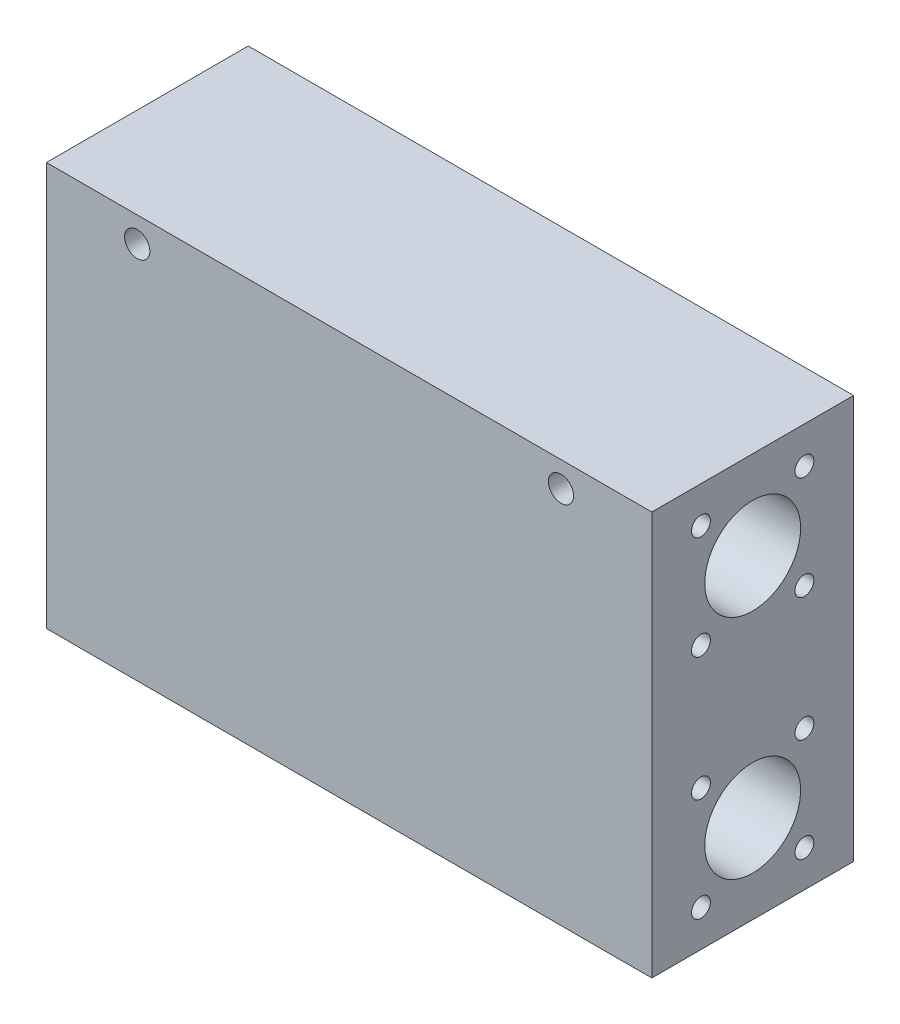
from build123d import *

# Parameters (mm, degrees)
SKETCH1_W                        = 120
SKETCH1_H                        = 80
BOSS_EXTRUDE1_DEPTH              = 40
SKETCH2_R                        = 1.85
LINEAR_BEARING_SCREW_CUTS_DEPTH  = 14
SKETCH3_R                        = 9.5
LINEAR_BEARINGS_HOLE_DEPTH       = 55
SKETCH4_R                        = 1.875
LINEAR_BEARING_SCREW_CUTS2_DEPTH = 14
LINEAR_BEARINGS_HOLE2_START      = -55
SKETCH5_R                        = 9.5
LINEAR_BEARINGS_HOLE2_DEPTH      = 55
SKETCH12_R                       = 6
CUT_EXTRUDE9_DEPTH               = 111.566721937
SKETCH13_R                       = 2.5
CUT_EXTRUDE10_DEPTH              = 150.666295471


with BuildPart() as part:
    # Sketch1 → Boss-Extrude1 (new body)
    with BuildSketch(Plane.XY):
        with Locations((60, 40)):
            Rectangle(SKETCH1_W, SKETCH1_H)
    extrude(amount=BOSS_EXTRUDE1_DEPTH)

    # Sketch2 → linear-bearing-screw-cuts (cut)
    with BuildSketch(Plane.ZY):
        with Locations((30.25, 72.75)):
            Circle(SKETCH2_R)
        with Locations((9.75, 72.75)):
            Circle(SKETCH2_R)
        with Locations((30.25, 52.25)):
            Circle(SKETCH2_R)
        with Locations((9.75, 52.25)):
            Circle(SKETCH2_R)
        with Locations((9.75, 27.75)):
            Circle(SKETCH2_R)
        with Locations((30.25, 27.75)):
            Circle(SKETCH2_R)
        with Locations((30.25, 7.25)):
            Circle(SKETCH2_R)
        with Locations((9.75, 7.25)):
            Circle(SKETCH2_R)
    extrude(amount=-LINEAR_BEARING_SCREW_CUTS_DEPTH, mode=Mode.SUBTRACT)

    # Sketch3 → linear-bearings-hole (cut)
    with BuildSketch(Plane.ZY):
        with Locations((20, 62.5)):
            Circle(SKETCH3_R)
        with Locations((20, 17.5)):
            Circle(SKETCH3_R)
    extrude(amount=-LINEAR_BEARINGS_HOLE_DEPTH, mode=Mode.SUBTRACT)

    # Sketch4 → linear-bearing-screw-cuts2 (cut)
    with BuildSketch(Plane(origin=(120, 0, 0), x_dir=(0, 0, -1), z_dir=(1, 0, 0))):
        with Locations((-9.75, 72.75)):
            Circle(SKETCH4_R)
        with Locations((-30.25, 72.75)):
            Circle(SKETCH4_R)
        with Locations((-9.75, 52.25)):
            Circle(SKETCH4_R)
        with Locations((-30.25, 52.25)):
            Circle(SKETCH4_R)
        with Locations((-30.25, 27.75)):
            Circle(SKETCH4_R)
        with Locations((-9.75, 27.75)):
            Circle(SKETCH4_R)
        with Locations((-9.75, 7.25)):
            Circle(SKETCH4_R)
        with Locations((-30.25, 7.25)):
            Circle(SKETCH4_R)
    extrude(amount=-LINEAR_BEARING_SCREW_CUTS2_DEPTH, mode=Mode.SUBTRACT)

    # Sketch5 → linear-bearings-hole2 (cut)
    with BuildSketch(Plane(origin=(120, 0, 0), x_dir=(0, 0, -1), z_dir=(1, 0, 0)).offset(LINEAR_BEARINGS_HOLE2_START)):
        with Locations((-20, 62.5)):
            Circle(SKETCH5_R)
        with Locations((-20, 17.5)):
            Circle(SKETCH5_R)
    extrude(amount=LINEAR_BEARINGS_HOLE2_DEPTH, mode=Mode.SUBTRACT)

    # Sketch12 → Cut-Extrude9 (cut, through all)
    with BuildSketch(Plane(origin=(65, 0, 0), x_dir=(0, 0, -1), z_dir=(1, 0, 0))):
        with Locations((-20, 62.5)):
            Circle(SKETCH12_R)
        with Locations((-20, 17.5)):
            Circle(SKETCH12_R)
    extrude(amount=-CUT_EXTRUDE9_DEPTH, mode=Mode.SUBTRACT)

    # Sketch13 → Cut-Extrude10 (cut, through all)
    with BuildSketch(Plane(origin=(0, 0, 0), x_dir=(-1, 0, 0), z_dir=(0, 0, -1))):
        with Locations((-102, 75)):
            Circle(SKETCH13_R)
        with Locations((-18, 75)):
            Circle(SKETCH13_R)
    extrude(amount=-CUT_EXTRUDE10_DEPTH, mode=Mode.SUBTRACT)


solid = part.part
